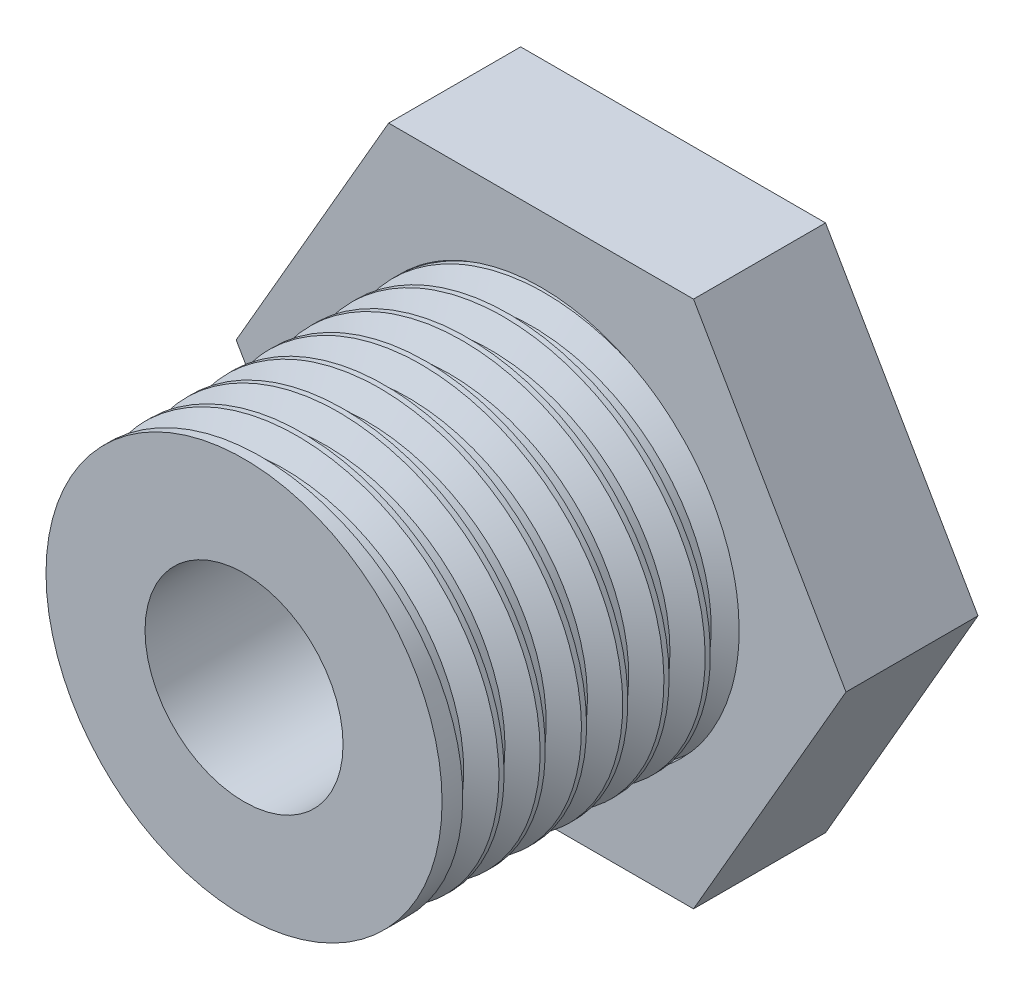
from build123d import *

# Parameters (mm, degrees)
BOSS_EXTRUDE1_DEPTH = 4
SKETCH2_R           = 6
BOSS_EXTRUDE2_DEPTH = 9
SKETCH3_R           = 3
CUT_EXTRUDE1_DEPTH  = 18.841898255
THREAD1_PITCH       = 1.25


with BuildPart() as part:
    # Sketch1 → Boss-Extrude1 (new body)
    with BuildSketch(Plane.XY):
        Polygon((9.237604307, 0), (4.618802154, 8), (-4.618802154, 8), (-9.237604307, 0), (-4.618802154, -8), (4.618802154, -8), align=None)
    extrude(amount=BOSS_EXTRUDE1_DEPTH)

    # Sketch2 → Boss-Extrude2 (add)
    with BuildSketch(Plane.XY.offset(4)):
        Circle(SKETCH2_R)
    extrude(amount=BOSS_EXTRUDE2_DEPTH)

    # Sketch3 → Cut-Extrude1 (cut, through all)
    with BuildSketch(Plane.XY.offset(13)):
        Circle(SKETCH3_R)
    extrude(amount=-CUT_EXTRUDE1_DEPTH, mode=Mode.SUBTRACT)

    # Thread1: the profile of Thread Profile1 profile screwed along a right-hand helix of 7.2 turns, 8 arcs to a turn; built about Z, then put on its axis
    thread1_z = Axis((0, 0, 0), (0, 0, 1))
    thread1_corners = [(6.0003, 0, -0.000173205), (6.0003, 0, 1.093923202), (5.323417656, 0, 0.703124998), (5.323417656, 0, 0.390624998)]
    with BuildLine(mode=Mode.PRIVATE) as thread1_profile:
        Line(thread1_corners[0], thread1_corners[1])
        Line(thread1_corners[1], thread1_corners[2])
        Line(thread1_corners[2], thread1_corners[3])
        Line(thread1_corners[3], thread1_corners[0])
    thread1_cap = Face(thread1_profile.wire())
    thread1_turn_angles = [0, 22.5, 45, 67.5, 90, 112.5, 135, 157.5, 180, 202.5, 225, 247.5, 270, 292.5, 315, 337.5, 360]
    thread1_turn_weights = [1, 0.9238795325112867, 1, 0.9238795325112867, 1, 0.9238795325112867, 1, 0.9238795325112867, 1, 0.9238795325112867, 1, 0.9238795325112867, 1, 0.9238795325112867, 1, 0.9238795325112867, 1]
    thread1_turn_rails = [Edge.make_bspline([Vector(p[0], p[1], 0).rotate(thread1_z, thread1_turn_angles[k]) / thread1_turn_weights[k] + Vector(0, 0, p[2] + THREAD1_PITCH * thread1_turn_angles[k] / 360) for k in range(17)], [0, 0, 0, 1, 1, 2, 2, 3, 3, 4, 4, 5, 5, 6, 6, 7, 7, 8, 8, 8], 2, thread1_turn_weights) for p in thread1_corners]
    thread1_turn_sides = [Face.make_surface_from_curves(thread1_turn_rails[p[0]], thread1_turn_rails[p[1]]) for p in [(0, 1), (1, 2), (2, 3), (3, 0)]]
    thread1_last_angles = [2520, 2542.5, 2565, 2578.5, 2592]
    thread1_last_weights = [1, 0.9238795325112867, 1, 0.9723699203976766, 1]
    thread1_last_rails = [Edge.make_bspline([Vector(p[0], p[1], 0).rotate(thread1_z, thread1_last_angles[k]) / thread1_last_weights[k] + Vector(0, 0, p[2] + THREAD1_PITCH * thread1_last_angles[k] / 360) for k in range(5)], [0, 0, 0, 1, 1, 2, 2, 2], 2, thread1_last_weights) for p in thread1_corners]
    thread1_last_sides = [Face.make_surface_from_curves(thread1_last_rails[p[0]], thread1_last_rails[p[1]]) for p in [(0, 1), (1, 2), (2, 3), (3, 0)]]
    thread1 = Plane(origin=(0, 0, 13), x_dir=(-1, 0, 0), z_dir=(0, 0, -1)) * Solid(Shell([*[p.moved(Location((0, 0, THREAD1_PITCH * i))) for i in range(7) for p in thread1_turn_sides], *thread1_last_sides, thread1_cap, thread1_cap.rotate(thread1_z, 2592).moved(Location((0, 0, THREAD1_PITCH * 2592 / 360)))]))
    add(thread1, mode=Mode.SUBTRACT)


solid = part.part
